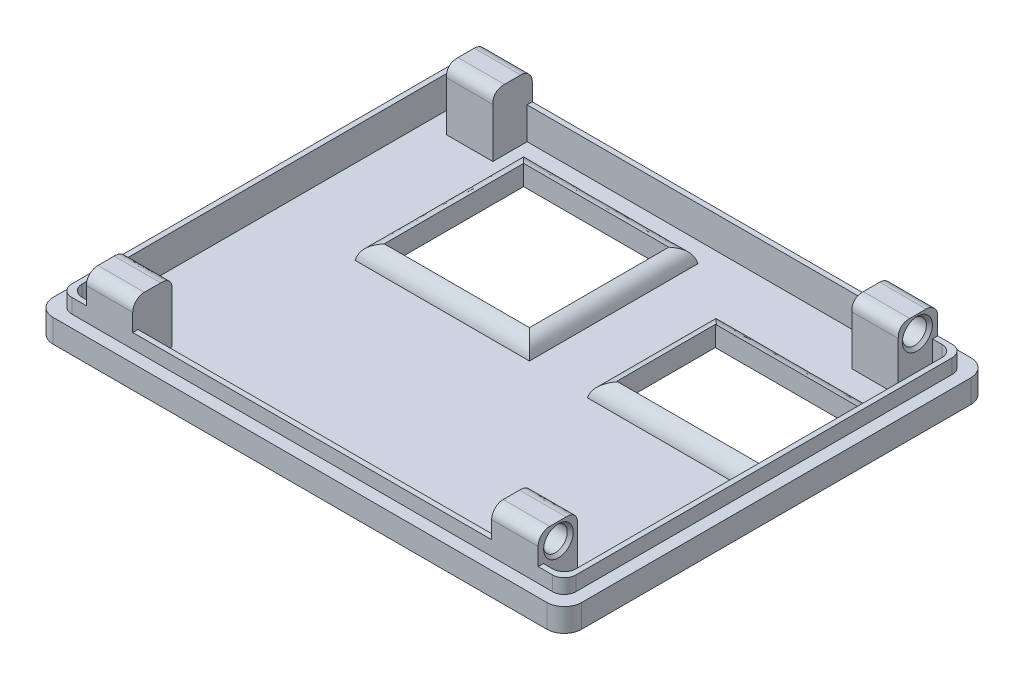
from build123d import *

# Parameters (mm, degrees)
SKETCH_1_W                  = 91
SKETCH_1_H                  = 73
EXTRUDE_1_DEPTH             = 4
SKETCH_2_W                  = 86.8
SKETCH_2_H                  = 68.8
EXTRUDE_2_DEPTH             = 2.5
SKETCH_4_W                  = 85
SKETCH_4_H                  = 67
CUT_EXTRUDE_1_DEPTH         = 5.5
FILLET_1_R                  = 2
FILLET_2_R                  = 2
SKETCH_5_W                  = 8
SKETCH_5_H                  = 8.5
EXTRUDE_3_DEPTH             = 5
EXTRUDE_3_DIRECTION_2_REACH = 118.843
SKETCH_8_R                  = 2.05
CUT_EXTRUDE_2_DEPTH         = 6
CHAMFER_1_SIZE              = 0.5
CHAMFER_1_SIZE2             = 0.536184355
FILLET_3_R                  = 2
FILLET_6_R                  = 3
SKETCH_14_W                 = 27.5
SKETCH_14_H                 = 16.5
CUT_EXTRUDE_4_DEPTH         = 1.5
SKETCH_15_W                 = 25
SKETCH_15_H                 = 25
CUT_EXTRUDE_5_DEPTH         = 1.5
SKETCH_16_W                 = 27.5
SKETCH_16_H                 = 2.5
CUT_EXTRUDE_6_DEPTH         = 10
SKETCH_17_W                 = 27.5
SKETCH_17_H                 = 2
EXTRUDE_4_DEPTH             = 1
SKETCH_18_W                 = 2
SKETCH_18_H                 = 25
CUT_EXTRUDE_7_DEPTH         = 2
SKETCH_19_W                 = 2
SKETCH_19_H                 = 25
EXTRUDE_5_DEPTH             = 1
SKETCH_20_W                 = 25
SKETCH_20_H                 = 1
EXTRUDE_6_DEPTH             = 1
SKETCH_21_W                 = 30
SKETCH_21_H                 = 22
EXTRUDE_7_DEPTH             = 2.5
SKETCH_22_W                 = 27.5
SKETCH_22_H                 = 17
CUT_EXTRUDE_8_DEPTH         = 2.5
SKETCH_23_W                 = 30
SKETCH_23_H                 = 29
EXTRUDE_8_DEPTH             = 2.5
SKETCH_24_W                 = 25
SKETCH_24_H                 = 24
CUT_EXTRUDE_9_DEPTH         = 2.5
FILLET_7_R                  = 3
FILLET_START                = 57
FILLET_10_DEPTH             = 31
FILLET_START_2              = 6.5
FILLET_11_DEPTH             = 29
FILLET_START_3              = 16
FILLET_11_2_DEPTH           = 33
SKETCH_25_W                 = 8
SKETCH_25_H                 = 10.5
CUT_EXTRUDE_10_DEPTH        = 1.7
FILLET_12_SIZE              = 2
CHAMFER_1_OF_MIRROR_8_SIZE2 = 0.5
CHAMFER_1_OF_MIRROR_8_SIZE  = 0.536184355
FILLET_3_OF_MIRROR_8_R      = 2
FILLET_12_OF_MIRROR_8_SIZE  = 2
MIRROR_START                = 12.6
MIRROR_9_OUTLINE_R          = 2.05
MIRROR_9_DEPTH              = 2
MIRROR_START_2              = 76.4
MIRROR_9_2_OUTLINE_R        = 2.05
MIRROR_9_2_DEPTH            = 2
MIRROR_START_3              = 6.6
MIRROR_9_4_OUTLINE_R        = 2.586184355
MIRROR_9_4_DEPTH            = 8
MIRROR_9_5_OUTLINE_R        = 2.586184355
MIRROR_9_5_DEPTH            = 8
MIRROR_9_6_OUTLINE_R        = 2.586184355
MIRROR_9_6_OUTLINE_R_2      = 2.05
MIRROR_9_6_DEPTH            = 2
MIRROR_9_7_OUTLINE_R        = 2.586184355
MIRROR_9_7_OUTLINE_R_2      = 2.05
MIRROR_9_7_DEPTH            = 2


with BuildPart() as part:
    # 草图1 → 凸台-拉伸1 (new body)
    with BuildSketch(Plane(origin=(0, 0, 0), x_dir=(1, 0, 0), z_dir=(0, 1, 0))):
        with Locations((45.5, -36.5)):
            Rectangle(SKETCH_1_W, SKETCH_1_H)
    extrude(amount=-EXTRUDE_1_DEPTH)

    # 草图2 → 凸台-拉伸2 (add)
    with BuildSketch(Plane(origin=(0, 0, 0), x_dir=(1, 0, 0), z_dir=(0, 1, 0))):
        with Locations((45.5, -36.5)):
            Rectangle(SKETCH_2_W, SKETCH_2_H)
    extrude(amount=EXTRUDE_2_DEPTH)

    # 草图4 → 切除-拉伸1 (cut)
    with BuildSketch(Plane(origin=(0, 2.5, 0), x_dir=(1, 0, 0), z_dir=(0, 1, 0))):
        with Locations((45.5, -36.5)):
            Rectangle(SKETCH_4_W, SKETCH_4_H)
    extrude(amount=-CUT_EXTRUDE_1_DEPTH, mode=Mode.SUBTRACT)

    # 圆角1
    fillet_1_edges = [part.edges().sort_by_distance(p)[0] for p in [
        (88.9, 1.25, 70.9),
        (88.9, 1.25, 2.1),
        (2.1, 1.25, 2.1),
        (2.1, 1.25, 70.9),
    ]]
    fillet(fillet_1_edges, radius=FILLET_1_R)

    # 圆角2
    fillet_2_edges = [part.edges().sort_by_distance(p)[0] for p in [
        (88, -0.25, 3),
        (88, -0.25, 70),
        (3, -0.25, 70),
        (3, -0.25, 3),
    ]]
    fillet(fillet_2_edges, radius=FILLET_2_R)

    # 草图5 → 凸台-拉伸3 (add)
    with BuildSketch(Plane(origin=(0, 2.5, 0), x_dir=(1, 0, 0), z_dir=(0, 1, 0))):
        with Locations((80.4, -66.65)):
            Rectangle(SKETCH_5_W, SKETCH_5_H)
    extrude_3 = extrude(amount=EXTRUDE_3_DEPTH)

    # 草图5 → 凸台-拉伸3 direction 2 (add, up to next)
    with BuildSketch(Plane(origin=(0, 2.5, 0), x_dir=(1, 0, 0), z_dir=(0, 1, 0)), mode=Mode.PRIVATE) as extrude_3_direction_2_sk1:
        with Locations((80.4, -66.65)):
            Rectangle(SKETCH_5_W, SKETCH_5_H)
    extrude_3_direction_2_tool1 = extrude(extrude_3_direction_2_sk1.sketch, amount=-EXTRUDE_3_DIRECTION_2_REACH, mode=Mode.PRIVATE) - part.part
    extrude_3_direction_2 = extrude_3_direction_2_tool1.solids().sort_by_distance((80.4, 2.5, 66.65))[0]
    add(extrude_3_direction_2)

    # 草图8 → 切除-拉伸2 (cut)
    with BuildSketch(Plane(origin=(84.4, 0, 0), x_dir=(0, 0, -1), z_dir=(1, 0, 0))):
        with Locations((-67.4, 4.6)):
            Circle(SKETCH_8_R)
    cut_extrude_2 = extrude(amount=-CUT_EXTRUDE_2_DEPTH, mode=Mode.SUBTRACT)

    # 倒角1
    chamfer_1_edges = [part.edges().sort_by_distance(p)[0] for p in [
        (84.4, 4.6, 69.45),
    ]]
    chamfer_1_side = [part.faces().sort_by_distance(p)[0] for p in [
        (84.4, 1.987670274, 66.246161261),
    ]]
    chamfer(chamfer_1_edges, length=CHAMFER_1_SIZE, length2=CHAMFER_1_SIZE2, reference=chamfer_1_side[0])

    # 圆角3
    fillet_3_edges = [part.edges().sort_by_distance(p)[0] for p in [
        (80.4, 7.5, 70.9),
    ]]
    fillet(fillet_3_edges, radius=FILLET_3_R)

    # 圆角6
    fillet_6_edges = [part.edges().sort_by_distance(p)[0] for p in [
        (0, -2, 0),
        (91, -2, 0),
        (91, -2, 73),
        (0, -2, 73),
    ]]
    fillet(fillet_6_edges, radius=FILLET_6_R)

    # 草图14 → 切除-拉伸4 (cut)
    with BuildSketch(Plane.XZ.offset(4)):
        with Locations((74.25, 22.75)):
            Rectangle(SKETCH_14_W, SKETCH_14_H)
    extrude(amount=-CUT_EXTRUDE_4_DEPTH, mode=Mode.SUBTRACT)

    # 草图15 → 切除-拉伸5 (cut)
    with BuildSketch(Plane.XZ.offset(4)):
        with Locations((30.5, 21.5)):
            Rectangle(SKETCH_15_W, SKETCH_15_H)
    extrude(amount=-CUT_EXTRUDE_5_DEPTH, mode=Mode.SUBTRACT)

    # 草图16 → 切除-拉伸6 (cut)
    with BuildSketch(Plane.XZ.offset(4)):
        with Locations((74.25, 32.25)):
            Rectangle(SKETCH_16_W, SKETCH_16_H)
    extrude(amount=-CUT_EXTRUDE_6_DEPTH, mode=Mode.SUBTRACT)

    # 草图17 → 凸台-拉伸4 (add)
    with BuildSketch(Plane.XZ.offset(4)):
        with Locations((74.25, 15.5)):
            Rectangle(SKETCH_17_W, SKETCH_17_H)
    extrude(amount=-EXTRUDE_4_DEPTH)

    # 草图18 → 切除-拉伸7 (cut)
    with BuildSketch(Plane.XZ.offset(4)):
        with Locations((44, 21.5)):
            Rectangle(SKETCH_18_W, SKETCH_18_H)
    extrude(amount=-CUT_EXTRUDE_7_DEPTH, mode=Mode.SUBTRACT)

    # 草图19 → 凸台-拉伸5 (add)
    with BuildSketch(Plane.XZ.offset(4)):
        with Locations((19, 21.5)):
            Rectangle(SKETCH_19_W, SKETCH_19_H)
    extrude(amount=-EXTRUDE_5_DEPTH)

    # 草图20 → 凸台-拉伸6 (add)
    with BuildSketch(Plane.XZ.offset(4)):
        with Locations((32.5, 33.5)):
            Rectangle(SKETCH_20_W, SKETCH_20_H)
    extrude(amount=-EXTRUDE_6_DEPTH)

    # 草图21 → 凸台-拉伸7 (add)
    with BuildSketch(Plane(origin=(0, -3, 0), x_dir=(1, 0, 0), z_dir=(0, 1, 0))):
        with Locations((73, -25)):
            Rectangle(SKETCH_21_W, SKETCH_21_H)
    extrude(amount=EXTRUDE_7_DEPTH)

    # 草图22 → 切除-拉伸8 (cut)
    with BuildSketch(Plane.XZ.offset(3)):
        with Locations((74.25, 25)):
            Rectangle(SKETCH_22_W, SKETCH_22_H)
    extrude(amount=-CUT_EXTRUDE_8_DEPTH, mode=Mode.SUBTRACT)

    # 草图23 → 凸台-拉伸8 (add)
    with BuildSketch(Plane(origin=(0, -3, 0), x_dir=(1, 0, 0), z_dir=(0, 1, 0))):
        with Locations((32.5, -21)):
            Rectangle(SKETCH_23_W, SKETCH_23_H)
    extrude(amount=EXTRUDE_8_DEPTH)

    # 草图24 → 切除-拉伸9 (cut)
    with BuildSketch(Plane.XZ.offset(3)):
        with Locations((32.5, 21)):
            Rectangle(SKETCH_24_W, SKETCH_24_H)
    extrude(amount=-CUT_EXTRUDE_9_DEPTH, mode=Mode.SUBTRACT)

    # 圆角7
    # the kernel refuses this fillet: 3 mm, written as the material it takes off along each edge
    with BuildSketch(Plane(origin=(58, -0.5, 43.395099729), x_dir=(1, 0, 0), z_dir=(0, 0, -1))) as fillet_7_piece_1:
        with BuildLine():
            CenterArc((2.958039892, 3), FILLET_7_R, 189.594068227, 80.405931773)
            Line((0, 2.5), (0, 0))
            Line((0, 0), (2.958039892, 0))
        make_face()
    extrude(amount=36.790199458, mode=Mode.SUBTRACT)

    # 圆角10: read off the stored shape, not the designer's step
    # 圆角10 outline → 圆角10 (cut)
    with BuildSketch(Plane.YZ.offset(FILLET_START)):
        with BuildLine():
            add(Edge.make_bspline(
                [(-0.5, 33.5), (-0.838343803, 35.661656197), (-3, 36)],
                knots=[0, 0, 0, 1, 1, 1], degree=2))
            Line((-0.5, 33.5), (-0.5, 36))
            Line((-0.5, 36), (-3, 36))
        make_face()
        with BuildLine():
            add(Edge.make_bspline(
                [(-3, 14), (-0.838343803, 14.338343803), (-0.5, 16.5)],
                knots=[0, 0, 0, 1, 1, 1], degree=2))
            Line((-3, 14), (-0.5, 14))
            Line((-0.5, 14), (-0.5, 16.5))
        make_face()
    extrude(amount=FILLET_10_DEPTH, mode=Mode.SUBTRACT)

    # 圆角11: read off the stored shape, not the designer's step
    # 圆角11 outline → 圆角11 (cut)
    with BuildSketch(Plane.XY.offset(FILLET_START_2)):
        with BuildLine():
            Line((17.5, -0.5), (17.5, -3))
            add(Edge.make_bspline(
                [(17.5, -3), (17.882851048, -0.735022653), (20, -0.522094259)],
                knots=[0, 0, 0, 0.905990939, 0.905990939, 0.905990939], degree=2))
            Line((20, -0.522094259), (20, -0.5))
            Line((20, -0.5), (17.5, -0.5))
        make_face()
        with BuildLine():
            Line((47.5, -0.5), (45, -0.5))
            Line((45, -0.5), (45, -0.522094259))
            add(Edge.make_bspline(
                [(47.5, -3), (47.117148952, -0.735022653), (45, -0.522094259)],
                knots=[0, 0, 0, 0.905990939, 0.905990939, 0.905990939], degree=2))
            Line((47.5, -3), (47.5, -0.5))
        make_face()
    extrude(amount=FILLET_11_DEPTH, mode=Mode.SUBTRACT)

    # Fillet 11 2 outline → Fillet 11 2 (cut)
    with BuildSketch(Plane.YZ.offset(FILLET_START_3)):
        with BuildLine():
            Line((-0.5, 35.5), (-3, 35.5))
            add(Edge.make_bspline(
                [(-3, 35.5), (-0.735022653, 35.117148952), (-0.522094259, 33)],
                knots=[0, 0, 0, 0.905990939, 0.905990939, 0.905990939], degree=2))
            Line((-0.522094259, 33), (-0.5, 33))
            Line((-0.5, 33), (-0.5, 35.5))
        make_face()
        with BuildLine():
            add(Edge.make_bspline(
                [(-3, 6.5), (-0.735022653, 6.882851048), (-0.522094259, 9)],
                knots=[0, 0, 0, 0.905990939, 0.905990939, 0.905990939], degree=2))
            Line((-3, 6.5), (-0.5, 6.5))
            Line((-0.5, 6.5), (-0.5, 9))
            Line((-0.5, 9), (-0.522094259, 9))
        make_face()
    extrude(amount=FILLET_11_2_DEPTH, mode=Mode.SUBTRACT)

    # 草图25 → 切除-拉伸10 (cut)
    with BuildSketch(Plane(origin=(0, 0, 62.4), x_dir=(-1, 0, 0), z_dir=(0, 0, -1))):
        with Locations((-80.4, 2.25)):
            Rectangle(SKETCH_25_W, SKETCH_25_H)
    cut_extrude_10 = extrude(amount=-CUT_EXTRUDE_10_DEPTH, mode=Mode.SUBTRACT)

    # 圆角12
    # a fillet whose section is not a circle: 2 mm, written as the material it takes off along each edge
    with BuildSketch(Plane(origin=(89.4, 7.5, 64.1), x_dir=(0, -1, 0), z_dir=(-1, 0, 0))) as fillet_12_piece_1:
        with BuildLine():
            Bezier((FILLET_12_SIZE, 0), (0, 0), (0, FILLET_12_SIZE), weights=[1, 1, 1])
            Line((0, FILLET_12_SIZE), (0, 0))
            Line((0, 0), (FILLET_12_SIZE, 0))
        make_face()
    extrude(amount=18, mode=Mode.SUBTRACT)

    # 镜向8: 凸台-拉伸3, 凸台-拉伸3 direction 2, 切除-拉伸2, 切除-拉伸10 across plane
    add(extrude_3.mirror(Plane(origin=(45.5, 0, 0), x_dir=(0, 0, 1), z_dir=(1, 0, 0))))
    add(extrude_3_direction_2.mirror(Plane(origin=(45.5, 0, 0), x_dir=(0, 0, 1), z_dir=(1, 0, 0))))
    add(cut_extrude_2.mirror(Plane(origin=(45.5, 0, 0), x_dir=(0, 0, 1), z_dir=(1, 0, 0))), mode=Mode.SUBTRACT)
    add(cut_extrude_10.mirror(Plane(origin=(45.5, 0, 0), x_dir=(0, 0, 1), z_dir=(1, 0, 0))), mode=Mode.SUBTRACT)

    # 倒角1 of 镜向8
    chamfer_1_of_mirror_8_edges = [part.edges().sort_by_distance(p)[0] for p in [
        (6.6, 4.6, 69.45),
    ]]
    chamfer(chamfer_1_of_mirror_8_edges, length=CHAMFER_1_OF_MIRROR_8_SIZE, length2=CHAMFER_1_OF_MIRROR_8_SIZE2)

    # 圆角3 of 镜向8
    fillet_3_of_mirror_8_edges = [part.edges().sort_by_distance(p)[0] for p in [
        (10.6, 7.5, 70.9),
    ]]
    fillet(fillet_3_of_mirror_8_edges, radius=FILLET_3_OF_MIRROR_8_R)

    # 圆角12 of 镜向8
    # a fillet whose section is not a circle: 2 mm, written as the material it takes off along each edge
    with BuildSketch(Plane(origin=(1.6, 7.5, 64.1), x_dir=(0, 0, 1), z_dir=(1, 0, 0))) as fillet_12_of_mirror_8_piece_1:
        with BuildLine():
            Bezier((FILLET_12_OF_MIRROR_8_SIZE, 0), (0, 0), (0, FILLET_12_OF_MIRROR_8_SIZE), weights=[1, 1, 1])
            Line((0, FILLET_12_OF_MIRROR_8_SIZE), (0, 0))
            Line((0, 0), (FILLET_12_OF_MIRROR_8_SIZE, 0))
        make_face()
    extrude(amount=18, mode=Mode.SUBTRACT)



with BuildPart() as body_2:
    # 镜向9: read off the stored shape, not the designer's step
    # 镜向9 outline → 镜向9 (new body)
    with BuildSketch(Plane.YZ.offset(MIRROR_START)):
        with Locations((4.6, 5.6)):
            Circle(MIRROR_9_OUTLINE_R)
    extrude(amount=MIRROR_9_DEPTH)



with BuildPart() as body_3:
    # Mirror 9 2 outline → Mirror 9 2 (new body)
    with BuildSketch(Plane.YZ.offset(MIRROR_START_2)):
        with Locations((4.6, 5.6)):
            Circle(MIRROR_9_2_OUTLINE_R)
    extrude(amount=MIRROR_9_2_DEPTH)


with BuildPart() as body_2_1:
    add(body_2.part)

    add(body_3.part)  # Mirror 9 3 merges body 3
    # Mirror 9 3 outline → Mirror 9 3 (revolve)
    with BuildSketch(Plane(origin=(0, 4.6, 5.6), x_dir=(0, 1, 0), z_dir=(0, 0, -1))):
        Polygon((2.05, 7.136184355), (2.55, 6.6), (2.586184355, 6.6), (2.586184355, 12.6), (2.05, 12.6), align=None)
        Polygon((2.05, 78.4), (2.586184355, 78.4), (2.586184355, 84.4), (2.05, 83.9), align=None)
    revolve(axis=Axis((0, 4.6, 5.6), (1, 0, 0)))


with BuildPart() as part_1:
    add(part.part)

    add(body_2_1.part)  # Mirror 9 4 merges body 2
    # Mirror 9 4 outline → Mirror 9 4 (add)
    with BuildSketch(Plane.YZ.offset(MIRROR_START_3)):
        with BuildLine():
            Line((7.5, 4.1), (7.5, 6.9))
            add(Edge.make_bspline(
                [(7.5, 6.9), (7.5, 8.9), (5.5, 8.9)],
                knots=[0, 0, 0, 1, 1, 1], degree=2))
            Line((5.5, 8.9), (-3, 8.9))
            Line((-3, 8.9), (-3, 3))
            Line((-3, 3), (2.5, 3))
            Line((2.5, 3), (2.5, 2.1))
            Line((2.5, 2.1), (5.5, 2.1))
            ThreePointArc((5.5, 2.1), (6.914213562, 2.685786438), (7.5, 4.1))
        make_face()
        with Locations((4.6, 5.6)):
            Circle(MIRROR_9_4_OUTLINE_R, mode=Mode.SUBTRACT)
    extrude(amount=MIRROR_9_4_DEPTH)

    # Mirror 9 5 outline → Mirror 9 5 (add)
    with BuildSketch(Plane.YZ.offset(MIRROR_START_2)):
        with BuildLine():
            Line((7.5, 4.1), (7.5, 6.9))
            add(Edge.make_bspline(
                [(7.5, 6.9), (7.5, 8.9), (5.5, 8.9)],
                knots=[0, 0, 0, 1, 1, 1], degree=2))
            Line((5.5, 8.9), (-3, 8.9))
            Line((-3, 8.9), (-3, 3))
            Line((-3, 3), (2.5, 3))
            Line((2.5, 3), (2.5, 2.1))
            Line((2.5, 2.1), (5.5, 2.1))
            ThreePointArc((5.5, 2.1), (6.914213562, 2.685786438), (7.5, 4.1))
        make_face()
        with Locations((4.6, 5.6)):
            Circle(MIRROR_9_5_OUTLINE_R, mode=Mode.SUBTRACT)
    extrude(amount=MIRROR_9_5_DEPTH)

    # Mirror 9 6 outline → Mirror 9 6 (add)
    with BuildSketch(Plane.YZ.offset(MIRROR_START)):
        with Locations((4.6, 5.6)):
            Circle(MIRROR_9_6_OUTLINE_R)
        with Locations((4.6, 5.6)):
            Circle(MIRROR_9_6_OUTLINE_R_2, mode=Mode.SUBTRACT)
    extrude(amount=MIRROR_9_6_DEPTH)

    # Mirror 9 7 outline → Mirror 9 7 (add)
    with BuildSketch(Plane.YZ.offset(MIRROR_START_2)):
        with Locations((4.6, 5.6)):
            Circle(MIRROR_9_7_OUTLINE_R)
        with Locations((4.6, 5.6)):
            Circle(MIRROR_9_7_OUTLINE_R_2, mode=Mode.SUBTRACT)
    extrude(amount=MIRROR_9_7_DEPTH)


solid = part_1.part
